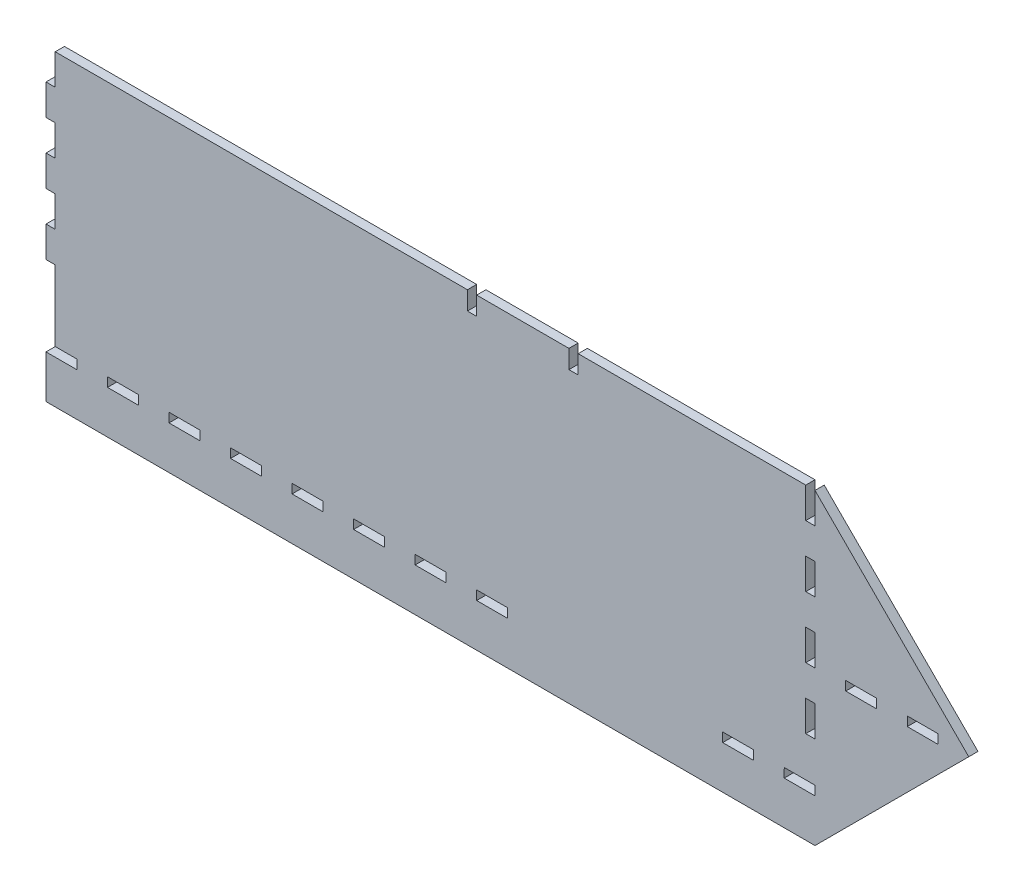
from build123d import *

# Parameters (mm, degrees)
SKETCH1_W           = 10
SKETCH1_H           = 3
SKETCH1_W_2         = 3
SKETCH1_H_2         = 10
BOSS_EXTRUDE1_DEPTH = 3


with BuildPart() as part:
    # Sketch1 → Boss-Extrude1 (new body)
    with BuildSketch(Plane.XY):
        Polygon((-112.631023813, -53.728350242), (-112.631023813, -67.728350242), (137.368976187, -67.728350242), (187.368976187, -17.728350242), (137.368976187, 32.271649758), (137.368976187, 22.271649758), (134.368976187, 22.271649758), (134.368976187, 32.271649758), (60.378976187, 32.271649758), (60.378976187, 26.271649758), (57.378976187, 26.271649758), (57.378976187, 32.271649758), (42.378976187, 32.271649758), (27.378976187, 32.271649758), (27.378976187, 26.271649758), (24.378976187, 26.271649758), (24.378976187, 32.271649758), (-62.631023813, 32.271649758), (-109.631023813, 32.271649758), (-109.631023813, 22.271649758), (-112.631023813, 22.271649758), (-112.631023813, 12.271649758), (-109.631023813, 12.271649758), (-109.631023813, 2.271649758), (-112.631023813, 2.271649758), (-112.631023813, -7.728350242), (-109.631023813, -7.728350242), (-109.631023813, -17.728350242), (-112.631023813, -17.728350242), (-112.631023813, -27.728350242), (-109.631023813, -27.728350242), (-109.631023813, -50.728350242), (-102.631023813, -50.728350242), (-102.631023813, -53.728350242), align=None)
        with Locations((-87.631023813, -52.228350242)):
            Rectangle(SKETCH1_W, SKETCH1_H, mode=Mode.SUBTRACT)
        with Locations((-67.631023813, -52.228350242)):
            Rectangle(SKETCH1_W, SKETCH1_H, mode=Mode.SUBTRACT)
        with Locations((-47.631023813, -52.228350242)):
            Rectangle(SKETCH1_W, SKETCH1_H, mode=Mode.SUBTRACT)
        with Locations((-27.631023813, -52.228350242)):
            Rectangle(SKETCH1_W, SKETCH1_H, mode=Mode.SUBTRACT)
        with Locations((-7.631023813, -52.228350242)):
            Rectangle(SKETCH1_W, SKETCH1_H, mode=Mode.SUBTRACT)
        with Locations((12.368976187, -52.228350242)):
            Rectangle(SKETCH1_W, SKETCH1_H, mode=Mode.SUBTRACT)
        Polygon((27.368976187, -50.728350242), (37.371405326, -50.728350242), (37.368976187, -53.728350242), (27.368976187, -53.728350242), align=None, mode=Mode.SUBTRACT)
        Polygon((107.3787447, -50.728350242), (117.381121881, -50.728350242), (117.369073889, -53.728350242), (107.369073889, -53.728350242), align=None, mode=Mode.SUBTRACT)
        Polygon((127.381202522, -50.728350242), (137.381202522, -50.728350242), (137.36915453, -53.728350242), (127.36915453, -53.728350242), align=None, mode=Mode.SUBTRACT)
        with Locations((135.868976187, -32.728350242)):
            Rectangle(SKETCH1_W_2, SKETCH1_H_2, mode=Mode.SUBTRACT)
        with Locations((135.868976187, -12.728350242)):
            Rectangle(SKETCH1_W_2, SKETCH1_H_2, mode=Mode.SUBTRACT)
        with Locations((152.368976187, -17.728350242)):
            Rectangle(SKETCH1_W, SKETCH1_H, mode=Mode.SUBTRACT)
        with Locations((172.368976187, -17.728350242)):
            Rectangle(SKETCH1_W, SKETCH1_H, mode=Mode.SUBTRACT)
        with Locations((135.868976187, 7.271649758)):
            Rectangle(SKETCH1_W_2, SKETCH1_H_2, mode=Mode.SUBTRACT)
    extrude(amount=BOSS_EXTRUDE1_DEPTH)


solid = part.part
